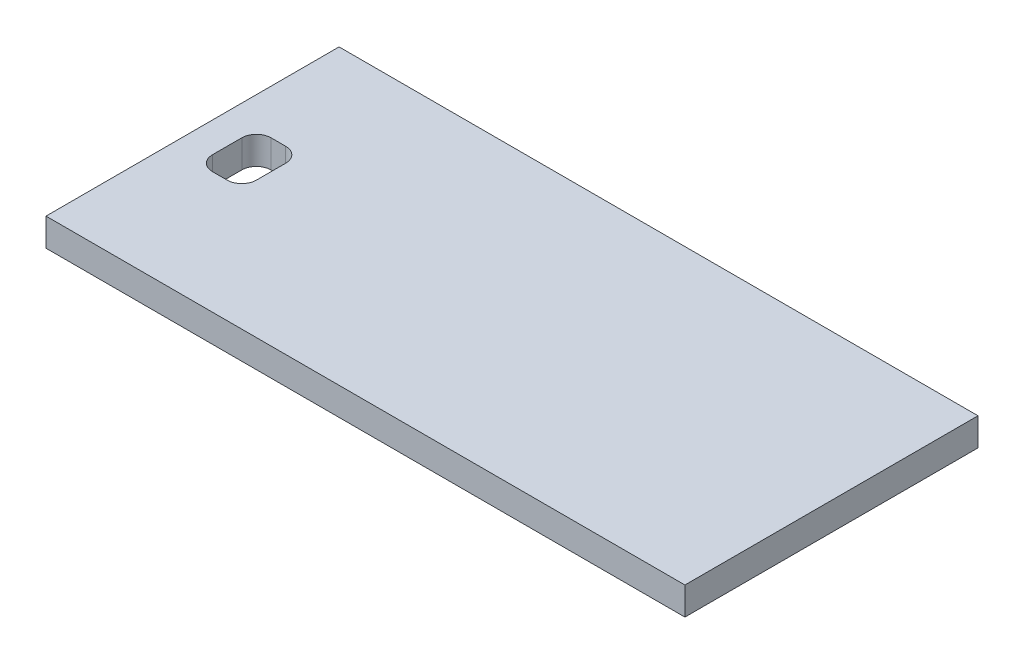
from build123d import *

# Parameters (mm, degrees)
SKETCH_1_W          = 218
SKETCH_1_H          = 100
EXTRUDE_1_DEPTH     = 9.5
SKETCH_2_W          = 15
SKETCH_2_H          = 20
CUT_EXTRUDE_1_DEPTH = 121.296508678
FILLET_1_R          = 5


with BuildPart() as part:
    # 草图1 → 凸台-拉伸1 (new body)
    with BuildSketch(Plane(origin=(0, 0, 0), x_dir=(1, 0, 0), z_dir=(0, 1, 0))):
        Rectangle(SKETCH_1_W, SKETCH_1_H)
    extrude(amount=EXTRUDE_1_DEPTH)

    # 草图2 → 切除-拉伸1 (cut, through all)
    with BuildSketch(Plane(origin=(0, 9.5, 0), x_dir=(1, 0, 0), z_dir=(0, 1, 0))):
        with Locations((-91.234833292, 1.528825843)):
            Rectangle(SKETCH_2_W, SKETCH_2_H)
    extrude(amount=-CUT_EXTRUDE_1_DEPTH, mode=Mode.SUBTRACT)

    # 圆角1
    fillet_1_edges = [part.edges().sort_by_distance(p)[0] for p in [
        (-98.734833292, 4.75, 8.471174157),
        (-83.734833292, 4.75, 8.471174157),
        (-83.734833292, 4.75, -11.528825843),
        (-98.734833292, 4.75, -11.528825843),
    ]]
    fillet(fillet_1_edges, radius=FILLET_1_R)


solid = part.part
